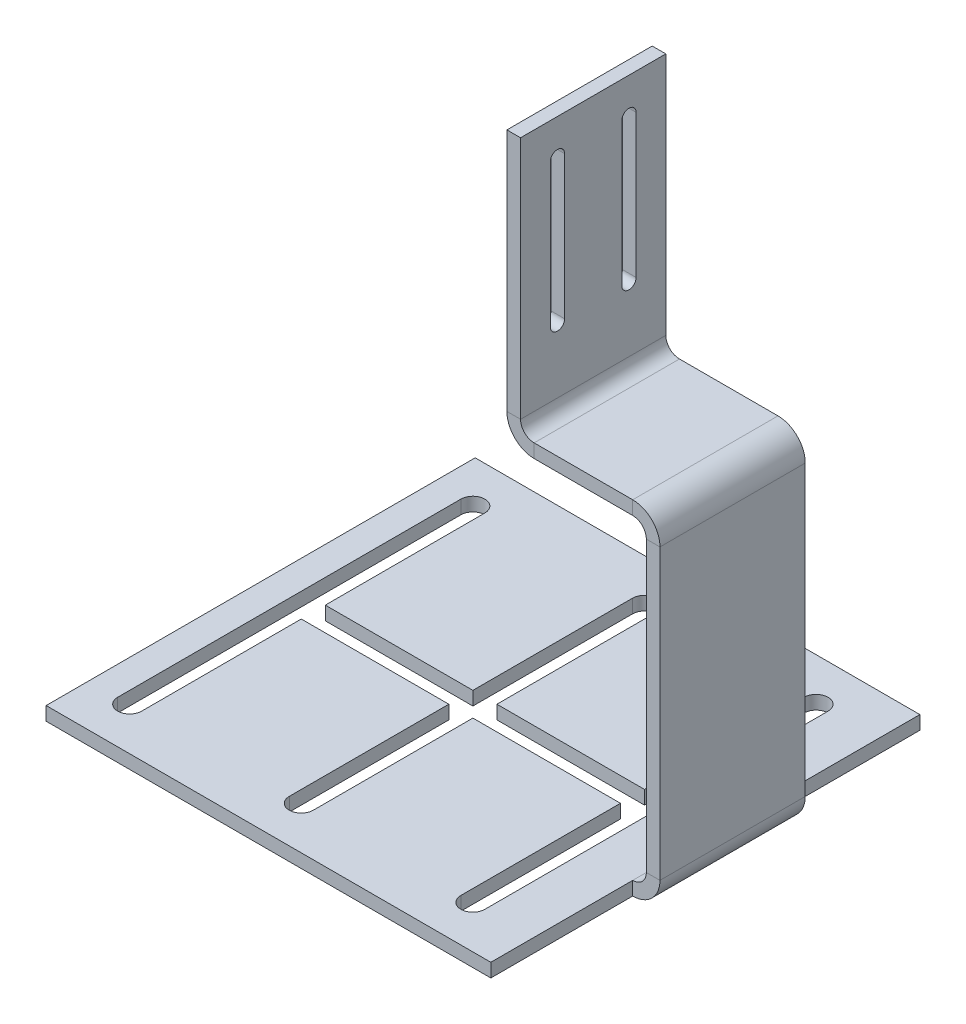
from build123d import *

# Parameters (mm, degrees)
BRIDA_BASE1_DEPTH           = 75
CORTAR_EXTRUIR1_START       = -9.525
CORTAR_EXTRUIR1_OUTLINE_W   = 49.6
CORTAR_EXTRUIR1_OUTLINE_H   = 121
CORTAR_EXTRUIR1_DEPTH       = 9.525
CORTAR_EXTRUIR1_START_2     = -53.5025
CORTAR_EXTRUIR1_2_OUTLINE_W = 49.6
CORTAR_EXTRUIR1_2_OUTLINE_H = 94.7625
CORTAR_EXTRUIR1_2_DEPTH     = 43.9775
CORTAR_EXTRUIR2_DEPTH       = 10
CORTAR_EXTRUIR3_DEPTH       = 10


# Read off the part's stored shape, not the designer's step: Cortar-Extruir1
# Sheet-metal steps are written as plain solids
with BuildPart() as part:
    # Croquis1 → Brida base1 (new, symmetric)
    with BuildSketch(Plane.XY):
        with BuildLine():
            Line((33.76, 105), (33.76, 19.7625))
            ThreePointArc((33.76, 19.7625), (35.154903955, 16.394903955), (38.5225, 15))
            Line((38.5225, 15), (72.975, 15))
            ThreePointArc((72.975, 15), (79.710192091, 12.210192091), (82.5, 5.475))
            Line((82.5, 5.475), (82.5, -95.475))
            ThreePointArc((82.5, -95.475), (79.710192091, -102.210192091), (72.975, -105))
            Line((72.975, -105), (-82.5, -105))
            Line((-82.5, -105), (-82.5, -100.2375))
            Line((-82.5, -100.2375), (72.975, -100.2375))
            ThreePointArc((72.975, -100.2375), (76.342596045, -98.842596045), (77.7375, -95.475))
            Line((77.7375, -95.475), (77.7375, 5.475))
            ThreePointArc((77.7375, 5.475), (76.342596045, 8.842596045), (72.975, 10.2375))
            Line((72.975, 10.2375), (38.5225, 10.2375))
            ThreePointArc((38.5225, 10.2375), (31.787307909, 13.027307909), (28.9975, 19.7625))
            Line((28.9975, 19.7625), (28.9975, 105))
            Line((28.9975, 105), (33.76, 105))
        make_face()
    extrude(amount=BRIDA_BASE1_DEPTH, both=True)

    # Cortar-Extruir1 outline → Cortar-Extruir1 (cut)
    with BuildSketch(Plane(origin=(82.5, 0, 0), x_dir=(0, 0, -1), z_dir=(1, 0, 0)).offset(CORTAR_EXTRUIR1_START)):
        with Locations((50.2, -45.5)):
            Rectangle(CORTAR_EXTRUIR1_OUTLINE_W, CORTAR_EXTRUIR1_OUTLINE_H)
        with Locations((-50.2, -45.5)):
            Rectangle(CORTAR_EXTRUIR1_OUTLINE_W, CORTAR_EXTRUIR1_OUTLINE_H)
    extrude(amount=CORTAR_EXTRUIR1_DEPTH, mode=Mode.SUBTRACT)

    # Cortar-Extruir1 2 outline → Cortar-Extruir1 2 (cut)
    with BuildSketch(Plane(origin=(82.5, 0, 0), x_dir=(0, 0, -1), z_dir=(1, 0, 0)).offset(CORTAR_EXTRUIR1_START_2)):
        with Locations((50.2, 57.61875)):
            Rectangle(CORTAR_EXTRUIR1_2_OUTLINE_W, CORTAR_EXTRUIR1_2_OUTLINE_H)
        with Locations((-50.2, 57.61875)):
            Rectangle(CORTAR_EXTRUIR1_2_OUTLINE_W, CORTAR_EXTRUIR1_2_OUTLINE_H)
    extrude(amount=CORTAR_EXTRUIR1_2_DEPTH, mode=Mode.SUBTRACT)

    # Croquis7 → Cortar-Extruir2 (cut)
    with BuildSketch(Plane(origin=(33.76, 0, 0), x_dir=(0, 0, -1), z_dir=(1, 0, 0))):
        with BuildLine():
            Line((-15, 42.5), (-15, 67.5))
            ThreePointArc((-15, 67.5), (-12.5, 65), (-10, 67.5))
            Line((-10, 67.5), (-10, 42.5))
            ThreePointArc((-10, 42.5), (-12.5, 40), (-15, 42.5))
        make_face()
        with BuildLine():
            ThreePointArc((-15, 67.5), (-12.5, 65), (-10, 67.5))
            ThreePointArc((-10, 67.5), (-12.5, 70), (-15, 67.5))
        make_face()
        with BuildLine():
            ThreePointArc((-10, 67.5), (-12.5, 70), (-15, 67.5))
            Line((-15, 67.5), (-15, 92.5))
            ThreePointArc((-15, 92.5), (-12.5, 95), (-10, 92.5))
            Line((-10, 92.5), (-10, 67.5))
        make_face()
        with BuildLine():
            ThreePointArc((15, 67.5), (12.5, 70), (10, 67.5))
            Line((10, 67.5), (10, 92.5))
            ThreePointArc((10, 92.5), (12.5, 95), (15, 92.5))
            Line((15, 92.5), (15, 67.5))
        make_face()
        with BuildLine():
            ThreePointArc((10, 67.5), (12.5, 65), (15, 67.5))
            ThreePointArc((15, 67.5), (12.5, 70), (10, 67.5))
        make_face()
        with BuildLine():
            Line((10, 42.5), (10, 67.5))
            ThreePointArc((10, 67.5), (12.5, 65), (15, 67.5))
            Line((15, 67.5), (15, 42.5))
            ThreePointArc((15, 42.5), (12.5, 40), (10, 42.5))
        make_face()
    extrude(amount=-CORTAR_EXTRUIR2_DEPTH, mode=Mode.SUBTRACT)

    # Croquis8 → Cortar-Extruir3 (cut)
    with BuildSketch(Plane.XZ.offset(105)):
        with BuildLine():
            Line((-72.5, -60), (-72.5, 60))
            ThreePointArc((-72.5, 60), (-68.3, 64.2), (-64.1, 60))
            Line((-64.1, 60), (-64.1, -60))
            ThreePointArc((-64.1, -60), (-68.3, -64.2), (-72.5, -60))
        make_face()
        with BuildLine():
            Line((-12.5, -60), (-12.5, 60))
            ThreePointArc((-12.5, 60), (-8.3, 64.2), (-4.1, 60))
            Line((-4.1, 60), (-4.1, -60))
            ThreePointArc((-4.1, -60), (-8.3, -64.2), (-12.5, -60))
        make_face()
        with BuildLine():
            Line((47.5, -60), (47.5, 60))
            ThreePointArc((47.5, 60), (51.7, 64.2), (55.9, 60))
            Line((55.9, 60), (55.9, -60))
            ThreePointArc((55.9, -60), (51.7, -64.2), (47.5, -60))
        make_face()
        with BuildLine():
            Line((-68.3, 4.2), (51.7, 4.2))
            ThreePointArc((51.7, 4.2), (55.9, 0), (51.7, -4.2))
            Line((51.7, -4.2), (-68.3, -4.2))
            ThreePointArc((-68.3, -4.2), (-72.5, 0), (-68.3, 4.2))
        make_face()
    extrude(amount=-CORTAR_EXTRUIR3_DEPTH, mode=Mode.SUBTRACT)


solid = part.part
